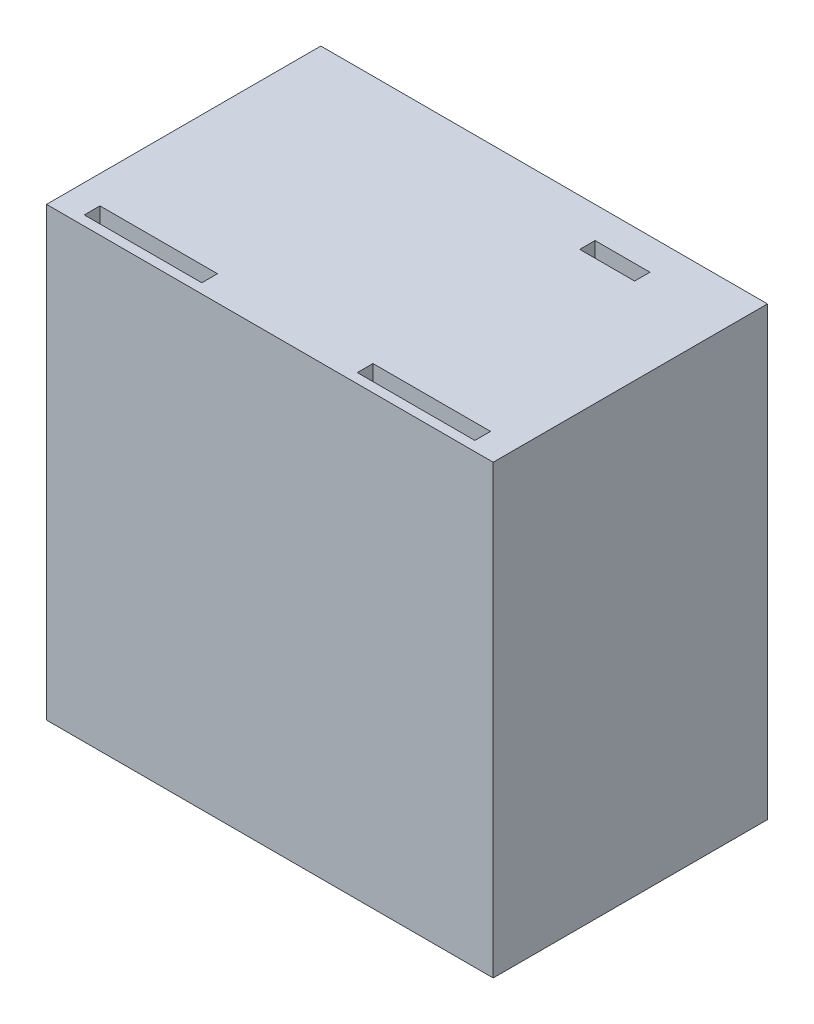
from build123d import *

# Parameters (mm, degrees)
SKETCH2_W           = 57
SKETCH2_H           = 57
BOSS_EXTRUDE1_DEPTH = 35
SKETCH3_W           = 15
SKETCH3_H           = 2
CUT_EXTRUDE1_DEPTH  = 60
SKETCH4_W           = 42
SKETCH4_H           = 42
CUT_EXTRUDE2_DEPTH  = 28
CUT_EXTRUDE4_DEPTH  = 5
CUT_EXTRUDE5_DEPTH  = 10
CUT_EXTRUDE6_DEPTH  = 5
SKETCH13_W          = 7
SKETCH13_H          = 1.952566844
CUT_EXTRUDE8_DEPTH  = 12
SHELL3_START        = 21.262135922
SHELL3_OUTLINE_W    = 9
SHELL3_OUTLINE_H    = 3.952566844
SHELL3_DEPTH        = 5.5
SHELL3_START_2      = -28.237864078
SHELL3_2_DEPTH      = 18
SHELL3_START_3      = 8.762135922
SHELL3_3_DEPTH      = 12.5
SHELL3_4_DEPTH      = 5.5
SHELL3_START_4      = 16.266990291
SHELL3_5_OUTLINE_W  = 19
SHELL3_5_OUTLINE_H  = 29.761209032
SHELL3_5_DEPTH      = 5.5
SHELL3_START_5      = -14.656416284
SHELL3_6_OUTLINE_W  = 19
SHELL3_6_OUTLINE_H  = 5
SHELL3_6_DEPTH      = 17.843406575
SHELL3_START_6      = -33.233009709
SHELL3_7_DEPTH      = 5.5
SHELL3_START_7      = -27.733009709
SHELL3_8_OUTLINE_W  = 19
SHELL3_8_OUTLINE_H  = 1.76
SHELL3_8_DEPTH      = 44
SHELL3_START_8      = 20.186990291
SHELL3_9_OUTLINE_W  = 19
SHELL3_9_OUTLINE_H  = 3.238790968
SHELL3_9_DEPTH      = 1.58
SHELL3_10_OUTLINE_W = 19
SHELL3_10_OUTLINE_H = 3.24
SHELL3_10_DEPTH     = 1.576593425
SHELL3_START_9      = 3.186990291
SHELL3_11_OUTLINE_W = 19
SHELL3_11_OUTLINE_H = 0.001209032
SHELL3_11_DEPTH     = 13.08


with BuildPart() as part:
    # Sketch2 → Boss-Extrude1 (new body)
    with BuildSketch(Plane.XY):
        with Locations((-5.733009709, -0.737864078)):
            Rectangle(SKETCH2_W, SKETCH2_H)
    extrude(amount=BOSS_EXTRUDE1_DEPTH)

    # Sketch3 → Cut-Extrude1 (cut)
    with BuildSketch(Plane(origin=(0, 27.762135922, 0), x_dir=(1, 0, 0), z_dir=(0, 1, 0))):
        with Locations((-23.156416284, -32.76)):
            Rectangle(SKETCH3_W, SKETCH3_H)
        with Locations((11.686990291, -32.761209032)):
            Rectangle(SKETCH3_W, SKETCH3_H)
    extrude(amount=-CUT_EXTRUDE1_DEPTH, mode=Mode.SUBTRACT)

    # Sketch4 → Cut-Extrude2 (cut)
    with BuildSketch(Plane(origin=(0, 0, 0), x_dir=(-1, 0, 0), z_dir=(0, 0, -1))):
        with Locations((5.733009709, -0.737864078)):
            Rectangle(SKETCH4_W, SKETCH4_H)
    extrude(amount=-CUT_EXTRUDE2_DEPTH, mode=Mode.SUBTRACT)

    # Sketch5 → Cut-Extrude4 (cut)
    with BuildSketch(Plane(origin=(0, -21.737864078, 0), x_dir=(1, 0, 0), z_dir=(0, 1, 0))):
        with BuildLine():
            Line((2.766990291, -11), (2.766990291, 0))
            Line((2.766990291, 0), (-14.233009709, 0))
            Line((-14.233009709, 0), (-14.233009709, -11))
            ThreePointArc((-14.233009709, -11), (-5.733009709, -19.5), (2.766990291, -11))
        make_face()
    extrude(amount=-CUT_EXTRUDE4_DEPTH, mode=Mode.SUBTRACT)

    # Sketch7 → Cut-Extrude5 (cut)
    with BuildSketch(Plane(origin=(-26.733009709, 0, 0), x_dir=(0, 0, -1), z_dir=(1, 0, 0))):
        with BuildLine():
            Line((-11, -9.237864078), (0, -9.237864078))
            Line((0, -9.237864078), (0, 7.762135922))
            Line((0, 7.762135922), (-11, 7.762135922))
            ThreePointArc((-11, 7.762135922), (-19.5, -0.737864078), (-11, -9.237864078))
        make_face()
    extrude(amount=-CUT_EXTRUDE5_DEPTH, mode=Mode.SUBTRACT)

    # Sketch8 → Cut-Extrude6 (cut)
    with BuildSketch(Plane(origin=(0, -26.737864078, 0), x_dir=(1, 0, 0), z_dir=(0, 1, 0))):
        with BuildLine():
            Line((-14.233009709, 0), (2.766990291, 0))
            Line((2.766990291, 0), (2.766990291, -11))
            ThreePointArc((2.766990291, -11), (-5.733009709, -19.5), (-14.233009709, -11))
            Line((-14.233009709, -11), (-14.233009709, 0))
        make_face()
    extrude(amount=-CUT_EXTRUDE6_DEPTH, mode=Mode.SUBTRACT)

    # Sketch13 → Cut-Extrude8 (cut)
    with BuildSketch(Plane(origin=(0, 27.762135922, 0), x_dir=(1, 0, 0), z_dir=(0, 1, 0))):
        with Locations((8.266990291, -4.976283422)):
            Rectangle(SKETCH13_W, SKETCH13_H)
    extrude(amount=-CUT_EXTRUDE8_DEPTH, mode=Mode.SUBTRACT)

    # Shell3: read off the stored shape, not the designer's step
    # Shell3 outline → Shell3 (cut)
    with BuildSketch(Plane(origin=(0, 0, 0), x_dir=(1, 0, 0), z_dir=(0, 1, 0)).offset(SHELL3_START)):
        Polygon((-14.656416284, -30.76), (-14.656416284, -34), (3.186990291, -34), (3.186990291, -30.761209032), (20.186990291, -30.761209032), (20.186990291, -34), (21.766990291, -34), (21.766990291, -1), (-33.233009709, -1), (-33.233009709, -34), (-31.656416284, -34), (-31.656416284, -30.76), align=None)
        with Locations((8.266990291, -4.976283422)):
            Rectangle(SHELL3_OUTLINE_W, SHELL3_OUTLINE_H, mode=Mode.SUBTRACT)
    extrude(amount=SHELL3_DEPTH, mode=Mode.SUBTRACT)

    # Shell3 2 outline → Shell3 2 (cut)
    with BuildSketch(Plane(origin=(0, 0, 0), x_dir=(1, 0, 0), z_dir=(0, 1, 0)).offset(SHELL3_START_2)):
        Polygon((-14.656416284, -30.76), (-14.656416284, -34), (3.186990291, -34), (3.186990291, -30.761209032), (20.186990291, -30.761209032), (20.186990291, -34), (21.766990291, -34), (21.766990291, -1), (16.266990291, -1), (16.266990291, -29), (-27.733009709, -29), (-27.733009709, -1), (-33.233009709, -1), (-33.233009709, -34), (-31.656416284, -34), (-31.656416284, -30.76), align=None)
    extrude(amount=SHELL3_2_DEPTH, mode=Mode.SUBTRACT)

    # Shell3 3 outline → Shell3 3 (cut)
    with BuildSketch(Plane(origin=(0, 0, 0), x_dir=(1, 0, 0), z_dir=(0, 1, 0)).offset(SHELL3_START_3)):
        Polygon((-14.656416284, -30.76), (-14.656416284, -34), (3.186990291, -34), (3.186990291, -30.761209032), (20.186990291, -30.761209032), (20.186990291, -34), (21.766990291, -34), (21.766990291, -1), (16.266990291, -1), (16.266990291, -29), (-27.733009709, -29), (-27.733009709, -1), (-33.233009709, -1), (-33.233009709, -34), (-31.656416284, -34), (-31.656416284, -30.76), align=None)
    extrude(amount=SHELL3_3_DEPTH, mode=Mode.SUBTRACT)

    # Shell3 4 outline → Shell3 4 (cut)
    with BuildSketch(Plane(origin=(0, 0, 0), x_dir=(1, 0, 0), z_dir=(0, 1, 0)).offset(SHELL3_START_2)):
        with BuildLine():
            Line((-15.233009709, -1), (-27.733009709, -1))
            Line((-27.733009709, -1), (-27.733009709, -29))
            Line((-27.733009709, -29), (16.266990291, -29))
            Line((16.266990291, -29), (16.266990291, -1))
            Line((16.266990291, -1), (3.766990291, -1))
            Line((3.766990291, -1), (3.766990291, -11))
            ThreePointArc((3.766990291, -11), (-5.733009709, -20.5), (-15.233009709, -11))
            Line((-15.233009709, -11), (-15.233009709, -1))
        make_face()
    extrude(amount=SHELL3_4_DEPTH, mode=Mode.SUBTRACT)

    # Shell3 5 outline → Shell3 5 (cut)
    with BuildSketch(Plane.YZ.offset(SHELL3_START_4)):
        with Locations((-0.737864078, 15.880604516)):
            Rectangle(SHELL3_5_OUTLINE_W, SHELL3_5_OUTLINE_H)
    extrude(amount=SHELL3_5_DEPTH, mode=Mode.SUBTRACT)

    # Shell3 6 outline → Shell3 6 (cut)
    with BuildSketch(Plane.YZ.offset(SHELL3_START_5)):
        with Locations((-0.737864078, 31.5)):
            Rectangle(SHELL3_6_OUTLINE_W, SHELL3_6_OUTLINE_H)
    extrude(amount=SHELL3_6_DEPTH, mode=Mode.SUBTRACT)

    # Shell3 7 outline → Shell3 7 (cut)
    with BuildSketch(Plane.YZ.offset(SHELL3_START_6)):
        with BuildLine():
            Line((8.762135922, 30.76), (-10.237864078, 30.76))
            Line((-10.237864078, 30.76), (-10.237864078, 11))
            ThreePointArc((-10.237864078, 11), (-0.737864078, 20.5), (8.762135922, 11))
            Line((8.762135922, 11), (8.762135922, 30.76))
        make_face()
    extrude(amount=SHELL3_7_DEPTH, mode=Mode.SUBTRACT)

    # Shell3 8 outline → Shell3 8 (cut)
    with BuildSketch(Plane.YZ.offset(SHELL3_START_7)):
        with Locations((-0.737864078, 29.88)):
            Rectangle(SHELL3_8_OUTLINE_W, SHELL3_8_OUTLINE_H)
    extrude(amount=SHELL3_8_DEPTH, mode=Mode.SUBTRACT)

    # Shell3 9 outline → Shell3 9 (cut)
    with BuildSketch(Plane.YZ.offset(SHELL3_START_8)):
        with Locations((-0.737864078, 32.380604516)):
            Rectangle(SHELL3_9_OUTLINE_W, SHELL3_9_OUTLINE_H)
    extrude(amount=SHELL3_9_DEPTH, mode=Mode.SUBTRACT)

    # Shell3 10 outline → Shell3 10 (cut)
    with BuildSketch(Plane.YZ.offset(SHELL3_START_6)):
        with Locations((-0.737864078, 32.38)):
            Rectangle(SHELL3_10_OUTLINE_W, SHELL3_10_OUTLINE_H)
    extrude(amount=SHELL3_10_DEPTH, mode=Mode.SUBTRACT)

    # Shell3 11 outline → Shell3 11 (cut)
    with BuildSketch(Plane.YZ.offset(SHELL3_START_9)):
        with Locations((-0.737864078, 30.760604516)):
            Rectangle(SHELL3_11_OUTLINE_W, SHELL3_11_OUTLINE_H)
    extrude(amount=SHELL3_11_DEPTH, mode=Mode.SUBTRACT)


solid = part.part
